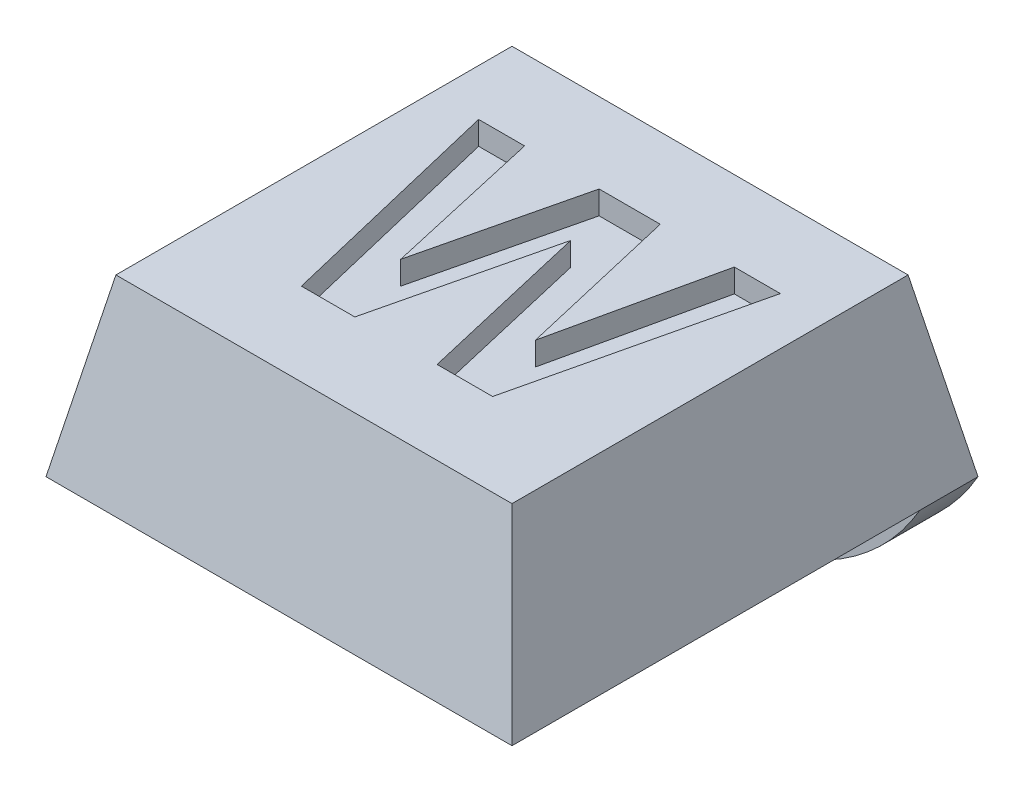
from build123d import *

# Parameters (mm, degrees)
SKETCH1_W               = 8
SKETCH1_H               = 8
BOSS_EXTRUDE1_DEPTH     = 3
CUT_EXTRUDE1_DEPTH      = 12.704699911
CUT_EXTRUDE1_DEPTH_BACK = 12.704699911
CUT_EXTRUDE2_DEPTH      = 11
SKETCH4_R               = 1.8
CUT_EXTRUDE3_DEPTH      = 0.8
SKETCH5_W               = 8
SKETCH5_H               = 1
BOSS_EXTRUDE2_DEPTH     = 2
FILLET1_R               = 4
CUT_EXTRUDE4_DEPTH      = 0.4


with BuildPart() as part:
    # Sketch1 → Boss-Extrude1 (new body)
    with BuildSketch(Plane(origin=(0, 0, 0), x_dir=(1, 0, 0), z_dir=(0, 1, 0))):
        with Locations((4, 4)):
            Rectangle(SKETCH1_W, SKETCH1_H)
    extrude(amount=BOSS_EXTRUDE1_DEPTH)

    # Sketch2 → Cut-Extrude1 (cut, two sides: drawn at the far end of the back side and taken through both)
    with BuildSketch(Plane.XY.offset(-CUT_EXTRUDE1_DEPTH_BACK)):
        Polygon((0, 0), (0.6, 3), (0, 3), align=None)
        Polygon((8, 0), (7.4, 3), (8, 3), align=None)
    extrude(amount=CUT_EXTRUDE1_DEPTH + CUT_EXTRUDE1_DEPTH_BACK, mode=Mode.SUBTRACT)

    # Sketch3 → Cut-Extrude2 (cut)
    with BuildSketch(Plane(origin=(0, 0, 0), x_dir=(0, 0, -1), z_dir=(1, 0, 0))):
        Polygon((0, 0), (0.6, 3), (0, 3), align=None)
        Polygon((8, 3), (7.4, 3), (8, 0), align=None)
    extrude(amount=CUT_EXTRUDE2_DEPTH, mode=Mode.SUBTRACT)

    # Sketch4 → Cut-Extrude3 (cut)
    with BuildSketch(Plane.XZ):
        with Locations(Location((4, -3.75, 0), (0, 0, 270))):
            Circle(SKETCH4_R)
    extrude(amount=-CUT_EXTRUDE3_DEPTH, mode=Mode.SUBTRACT)

    # Sketch5 → Boss-Extrude2 (add)
    with BuildSketch(Plane.XZ):
        with Locations((4, -7.5)):
            Rectangle(SKETCH5_W, SKETCH5_H)
    extrude(amount=BOSS_EXTRUDE2_DEPTH)

    # Fillet1
    # the kernel refuses this fillet: 4 mm, written as the material it takes off along each edge
    with BuildSketch(Plane(origin=(8, -2, -16.660254038), x_dir=(0, 1, 0), z_dir=(0, 0, 1)), Plane(origin=(0, -2, 1.660254038), x_dir=(0, 1, 0), z_dir=(0, 0, -1))) as fillet1_piece_1:
        with BuildLine():
            CenterArc((4, 3.464101615), FILLET1_R, 180, 60)
            Line((0, 3.464101615), (-0.08, 3.464101615))
            Line((-0.08, 3.464101615), (-0.08, 0))
            Line((-0.08, 0), (0, -0.08))
            ThreePointArc((0, -0.08), (1, -0.08), (1.96, -0.069282032))
            Line((1.96, -0.069282032), (2, 0))
        make_face()
    extrude(amount=18.320508076, mode=Mode.SUBTRACT)

    # Sketch6 → Cut-Extrude4 (cut)
    with BuildSketch(Plane(origin=(0, 3, 0), x_dir=(1, 0, 0), z_dir=(0, 1, 0))):
        Polygon((2.358967796, 2.025988971), (1.401435745, 6.025988971), (2.189897284, 6.025988971), (2.811692155, 3.278392817), (3.469544719, 6.025988971), (4.519224207, 6.025988971), (5.170666514, 3.231918458), (5.790858822, 6.025988971), (6.580922925, 6.025988971), (5.641019078, 2.025988971), (4.688294719, 2.025988971), (3.991179335, 5.016373586), (3.275634463, 2.025988971), align=None)
    extrude(amount=-CUT_EXTRUDE4_DEPTH, mode=Mode.SUBTRACT)


solid = part.part
